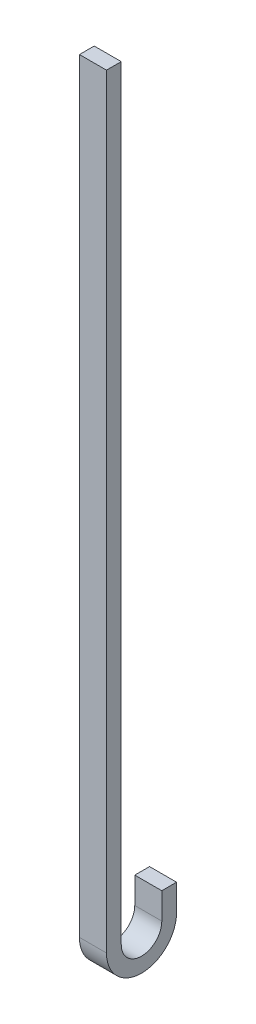
from build123d import *

# Parameters (mm, degrees)
BOSS_EXTRUDE1_DEPTH = 27.432


with BuildPart() as part:
    # Sketch1 → Boss-Extrude1 (new body)
    with BuildSketch(Plane(origin=(0, 0, 0), x_dir=(0, 0, -1), z_dir=(1, 0, 0))):
        with BuildLine():
            Line((0, 0), (0, -775.992482619))
            ThreePointArc((0, -775.992482619), (35.56, -811.552482619), (71.12, -775.992482619))
            Line((71.12, -775.992482619), (71.12, -749.3))
            Line((71.12, -749.3), (56.134, -749.3))
            Line((56.134, -749.3), (56.134, -775.992482619))
            ThreePointArc((56.134, -775.992482619), (35.56, -796.566482619), (14.986, -775.992482619))
            Line((14.986, -775.992482619), (14.986, 0))
            Line((14.986, 0), (0, 0))
        make_face()
    extrude(amount=BOSS_EXTRUDE1_DEPTH)


solid = part.part
